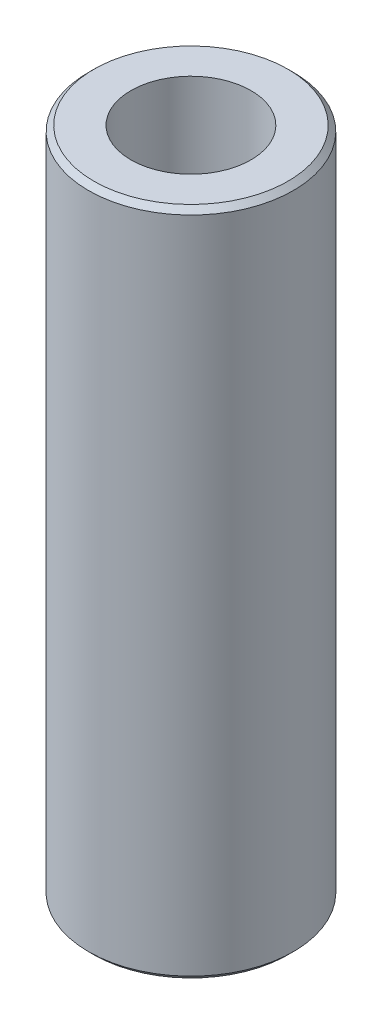
from build123d import *

# Parameters (mm, degrees)
SKETCH1_R           = 45
BOSS_EXTRUDE1_DEPTH = 294.297269747
SKETCH2_R           = 26.38689931
CUT_EXTRUDE1_DEPTH  = 302.099456958
CHAMFER1_SIZE       = 2.362541496


with BuildPart() as part:
    # Sketch1 → Boss-Extrude1 (new body)
    with BuildSketch(Plane(origin=(0, 0, 0), x_dir=(1, 0, 0), z_dir=(0, 1, 0))):
        Circle(SKETCH1_R)
    extrude(amount=BOSS_EXTRUDE1_DEPTH)

    # Sketch2 → Cut-Extrude1 (cut, through all)
    with BuildSketch(Plane(origin=(0, 0, 0), x_dir=(1, 0, 0), z_dir=(0, 1, 0))):
        Circle(SKETCH2_R)
    extrude(amount=CUT_EXTRUDE1_DEPTH, mode=Mode.SUBTRACT)

    # Chamfer1
    chamfer1_edges = [part.edges().sort_by_distance(p)[0] for p in [
        (-45, 294.297269747, 0),
        (-45, 0, 0),
    ]]
    chamfer(chamfer1_edges, length=CHAMFER1_SIZE)


solid = part.part
